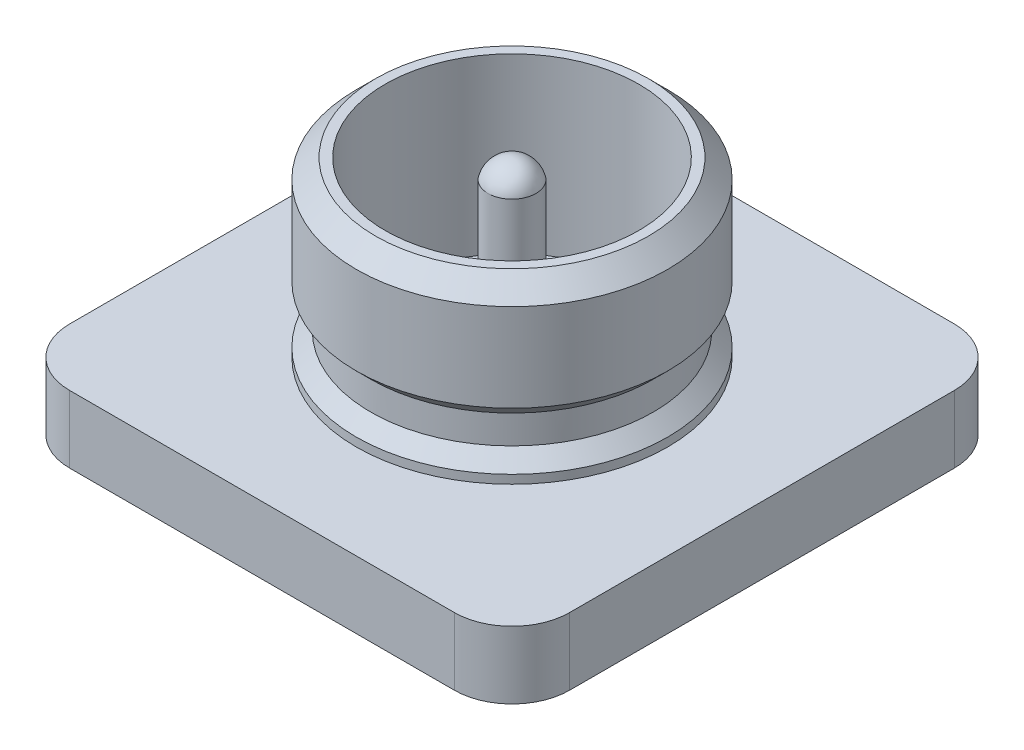
from build123d import *

# Parameters (mm, degrees)
SKETCH1_W           = 2.6
SKETCH1_H           = 2.6
BOSS_EXTRUDE1_DEPTH = 0.35
FILLET1_R           = 0.3
CHAMFER1_SIZE       = 0.1
CHAMFER2_SIZE       = 0.1
SKETCH4_R           = 0.125
BOSS_EXTRUDE2_DEPTH = 0.8
DOME1_FACE_RADIUS   = 0.125
DOME1_HEIGHT        = 0.1
SKETCH5_R           = 0.125
CUT_EXTRUDE2_DEPTH  = 0.34


with BuildPart() as part:
    # Sketch1 → Boss-Extrude1 (new body)
    with BuildSketch(Plane(origin=(0, 0, 0), x_dir=(1, 0, 0), z_dir=(0, 1, 0))):
        Rectangle(SKETCH1_W, SKETCH1_H)
    extrude(amount=BOSS_EXTRUDE1_DEPTH)

    # Fillet1
    fillet1_edges = [part.edges().sort_by_distance(p)[0] for p in [
        (1.3, 0.175, 1.3),
        (-1.3, 0.175, 1.3),
        (-1.3, 0.175, -1.3),
        (1.3, 0.175, -1.3),
    ]]
    fillet(fillet1_edges, radius=FILLET1_R)

    # Sketch3 → Revolve1 (revolve)
    with BuildSketch(Plane.XY, mode=Mode.PRIVATE) as revolve1_sk:
        Polygon((0.659628487, 0.35), (0.659628487, 1.25), (0.809628487, 1.25), (0.809628487, 0.592524264), (0.734628487, 0.592524264), (0.734628487, 0.494723207), (0.809628487, 0.494723207), (0.809628487, 0.35), align=None)
    revolve(revolve1_sk.sketch.rotate(Axis((0, -50, 0), (0, 1, 0)), 90), axis=Axis((0, -50, 0), (0, 1, 0)))

    # Chamfer1
    chamfer1_edges = [part.edges().sort_by_distance(p)[0] for p in [
        (0, 1.25, 0.809628487),
    ]]
    chamfer(chamfer1_edges, length=CHAMFER1_SIZE)

    # Chamfer2
    # the kernel refuses this chamfer: 0.1 mm, written as the material it takes off along each edge
    with BuildSketch(Plane(origin=(0, 0.494723207, 0), x_dir=(0, 0, -1), z_dir=(1, 0, 0))) as chamfer2_piece_1_section:
        Polygon((0.809628487 - CHAMFER2_SIZE, 0), (0.809628487, -CHAMFER2_SIZE), (0.809628487, 0), align=None)
    chamfer2_piece_1 = revolve(axis=Axis((0, 0.494723207, 0), (0, 1, 0)), mode=Mode.PRIVATE)
    chamfer2_piece_1 = chamfer2_piece_1 - Plane(origin=(0, 0.43287552, 0), x_dir=(0, 0, -1), z_dir=(0, -1, 0)) * Cylinder(0.734628487, 4, mode=Mode.PRIVATE)
    add(chamfer2_piece_1, mode=Mode.SUBTRACT)
    with BuildSketch(Plane(origin=(0, 0.592524264, 0), x_dir=(0, 0, -1), z_dir=(1, 0, 0))) as chamfer2_piece_2_section:
        Polygon((0.809628487, CHAMFER2_SIZE), (0.809628487 - CHAMFER2_SIZE, 0), (0.809628487, 0), align=None)
    chamfer2_piece_2 = revolve(axis=Axis((0, 0.592524264, 0), (0, 1, 0)), mode=Mode.PRIVATE)
    chamfer2_piece_2 = chamfer2_piece_2 - Plane(origin=(0, 0.65437195, 0), x_dir=(0, 0, -1), z_dir=(0, -1, 0)) * Cylinder(0.734628487, 4, mode=Mode.PRIVATE)
    add(chamfer2_piece_2, mode=Mode.SUBTRACT)

    # Sketch4 → Boss-Extrude2 (add)
    with BuildSketch(Plane(origin=(0, 0.35, 0), x_dir=(1, 0, 0), z_dir=(0, 1, 0))):
        with Locations(Location((0, 0, 0), (0, 0, 90))):
            Circle(SKETCH4_R)
    extrude(amount=BOSS_EXTRUDE2_DEPTH)

    # Dome1: a dome of height H over a round flat face of radius A is a cap of a sphere of radius (A * A + H * H) / (2 * H)
    dome1_r = (DOME1_FACE_RADIUS * DOME1_FACE_RADIUS + DOME1_HEIGHT * DOME1_HEIGHT) / (2 * DOME1_HEIGHT)
    dome1_base = Plane((0, 1.15, 0), z_dir=(0, 1, 0))
    with Locations(dome1_base.offset(DOME1_HEIGHT - dome1_r)):
        dome1_ball = Sphere(dome1_r, mode=Mode.PRIVATE)
    add(split(dome1_ball, bisect_by=dome1_base, keep=Keep.TOP, mode=Mode.PRIVATE))

    # Sketch5 → Cut-Extrude2 (cut)
    with BuildSketch(Plane.XZ):
        with Locations(Location((0, 0, 0), (0, 0, 270))):
            Circle(SKETCH5_R)
    extrude(amount=-CUT_EXTRUDE2_DEPTH, mode=Mode.SUBTRACT)


solid = part.part
